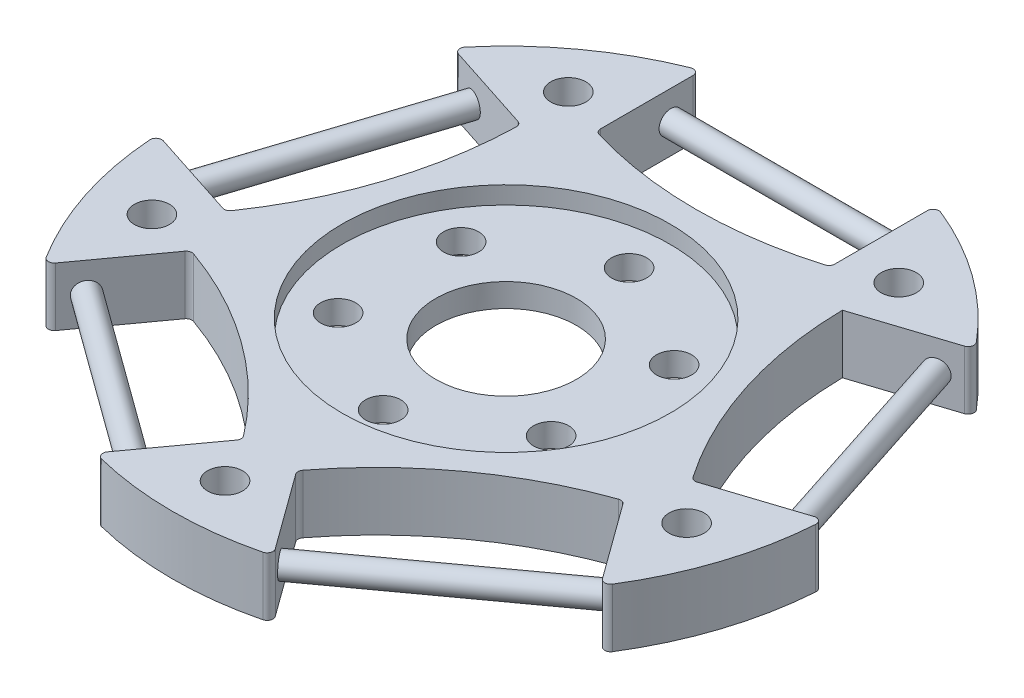
from build123d import *

# Parameters (mm, degrees)
SKETCH1_R           = 28.5
BOSS_EXTRUDE1_DEPTH = 5
CUT_EXTRUDE1_DEPTH  = 41.614036982
CIRPATTERN1_COUNT   = 5
SKETCH3_R           = 14
CUT_EXTRUDE2_DEPTH  = 1.5
SKETCH4_R           = 1.5
SKETCH4_R_2         = 6
CUT_EXTRUDE3_DEPTH  = 41.437031639
SKETCH5_R           = 1.5
CUT_EXTRUDE4_DEPTH  = 41.594378032
CIRPATTERN2_COUNT   = 5
FILLET1_R           = 0.5
BOSS_EXTRUDE2_REACH = 52.405
SKETCH7_R           = 1
CIRPATTERN3_COUNT   = 5


with BuildPart() as part:
    # Sketch1 → Boss-Extrude1 (new body)
    with BuildSketch(Plane(origin=(0, 0, 0), x_dir=(1, 0, 0), z_dir=(0, 1, 0))):
        Circle(SKETCH1_R)
    extrude(amount=BOSS_EXTRUDE1_DEPTH)

    # Sketch2 → Cut-Extrude1 (cut, through all)
    with BuildSketch(Plane(origin=(0, 5, 0), x_dir=(1, 0, 0), z_dir=(0, 1, 0))):
        with BuildLine():
            Line((10, 26.68801229), (10, 17.68801229))
            ThreePointArc((10, 17.68801229), (0, 16.180315356), (-10, 17.68801229))
            Line((-10, 17.68801229), (-10, 26.68801229))
            ThreePointArc((-10, 26.68801229), (0, 28.5), (10, 26.68801229))
        make_face()
    cut_extrude1 = extrude(amount=-CUT_EXTRUDE1_DEPTH, mode=Mode.SUBTRACT)

    # CirPattern1: Cut-Extrude1 ×5 about axis
    cirpattern1_axis = Axis((0, 5, 0), (0, 1, 0))
    for i in range(1, CIRPATTERN1_COUNT):
        add(cut_extrude1.rotate(cirpattern1_axis, i * 360 / CIRPATTERN1_COUNT), mode=Mode.SUBTRACT)

    # Sketch3 → Cut-Extrude2 (cut)
    with BuildSketch(Plane(origin=(0, 5, 0), x_dir=(1, 0, 0), z_dir=(0, 1, 0))):
        Circle(SKETCH3_R)
    cut_extrude2 = extrude(amount=-CUT_EXTRUDE2_DEPTH, mode=Mode.SUBTRACT)

    # Mirror1: Cut-Extrude2 across plane
    add(cut_extrude2.mirror(Plane.ZX.offset(2.5)), mode=Mode.SUBTRACT)

    # Sketch4 → Cut-Extrude3 (cut, through all)
    with BuildSketch(Plane(origin=(0, 3.5, 0), x_dir=(1, 0, 0), z_dir=(0, 1, 0))):
        with Locations((0, 10.5)):
            Circle(SKETCH4_R)
        with Locations((9.09326674, 5.25)):
            Circle(SKETCH4_R)
        with Locations((9.09326674, -5.25)):
            Circle(SKETCH4_R)
        with Locations((0, -10.5)):
            Circle(SKETCH4_R)
        with Locations((-9.09326674, -5.25)):
            Circle(SKETCH4_R)
        with Locations((-9.09326674, 5.25)):
            Circle(SKETCH4_R)
        Circle(SKETCH4_R_2)
    extrude(amount=-CUT_EXTRUDE3_DEPTH, mode=Mode.SUBTRACT)

    # Sketch5 → Cut-Extrude4 (cut, through all)
    with BuildSketch(Plane(origin=(0, 5, 0), x_dir=(1, 0, 0), z_dir=(0, 1, 0))):
        with Locations((0, -24)):
            Circle(SKETCH5_R)
    cut_extrude4 = extrude(amount=-CUT_EXTRUDE4_DEPTH, mode=Mode.SUBTRACT)

    # CirPattern2: Cut-Extrude4 ×5 about axis
    cirpattern2_axis = Axis((0, 3.5, 0), (0, 1, 0))
    for i in range(1, CIRPATTERN2_COUNT):
        add(cut_extrude4.rotate(cirpattern2_axis, i * 360 / CIRPATTERN2_COUNT), mode=Mode.SUBTRACT)

    # Fillet1
    fillet1_edges = [part.edges().sort_by_distance(p)[0] for p in [
        (10, 2.5, -17.68801229),
        (-10, 2.5, -17.68801229),
        (-13.732129405, 2.5, -14.976461557),
        (-19.912469293, 2.5, 4.044668769),
        (-18.48692271, 2.5, 8.432050017),
        (-2.306582823, 2.5, 20.187755062),
        (19.912469293, 2.5, 4.044668769),
        (18.48692271, 2.5, 8.432050017),
        (2.306582823, 2.5, 20.187755062),
        (10, 2.5, -26.68801229),
        (22.291638052, 2.5, -17.757614507),
        (28.471977939, 2.5, 1.263515819),
        (23.776989981, 2.5, 15.713202966),
        (7.596650093, 2.5, 27.468908012),
        (-7.596650093, 2.5, 27.468908012),
        (-23.776989981, 2.5, 15.713202966),
        (-28.471977939, 2.5, 1.263515819),
        (-22.291638052, 2.5, -17.757614507),
        (-10, 2.5, -26.68801229),
    ]]
    fillet(fillet1_edges, radius=FILLET1_R)

    # Sketch7 → Boss-Extrude2 (add, up to next)
    with BuildSketch(Plane(origin=(-8.090169944, 0, -5.877852523), x_dir=(0.5877852522924683, 0, -0.809016994374951), z_dir=(0.809016994374951, 0, 0.5877852522924683)), mode=Mode.PRIVATE) as boss_extrude2_sk1:
        with Locations((-24.059120617, 2.5)):
            Circle(SKETCH7_R)
    boss_extrude2_tool1 = extrude(boss_extrude2_sk1.sketch, amount=BOSS_EXTRUDE2_REACH, mode=Mode.PRIVATE) - part.part
    boss_extrude2 = boss_extrude2_tool1.solids().sort_by_distance((-22.231766, 2.5, 13.586385))[0]
    add(boss_extrude2)

    # CirPattern3: Boss-Extrude2 ×5 about axis
    cirpattern3_axis = Axis((0, 3.5, 0), (0, 1, 0))
    for i in range(1, CIRPATTERN3_COUNT):
        add(boss_extrude2.rotate(cirpattern3_axis, i * 360 / CIRPATTERN3_COUNT))


solid = part.part
